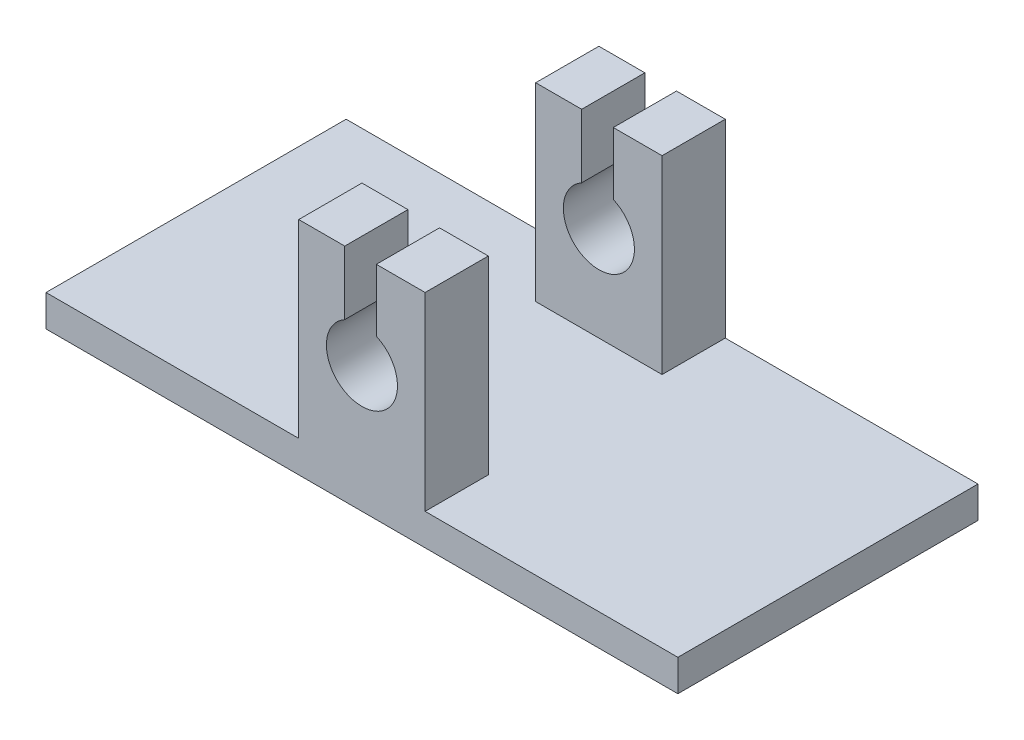
from build123d import *

# Parameters (mm, degrees)
SKETCH2_W           = 254
SKETCH2_H           = 120.65
BOSS_EXTRUDE2_DEPTH = 12.7
SKETCH4_W           = 50.8
SKETCH4_H           = 25.4
BOSS_EXTRUDE3_DEPTH = 76.2
CUT_EXTRUDE1_DEPTH  = 197.439895388


with BuildPart() as part:
    # Sketch2 → Boss-Extrude2 (new body)
    with BuildSketch(Plane(origin=(0, 0, 0), x_dir=(1, 0, 0), z_dir=(0, 1, 0))):
        Rectangle(SKETCH2_W, SKETCH2_H)
    extrude(amount=BOSS_EXTRUDE2_DEPTH)

    # Sketch4 → Boss-Extrude3 (add)
    with BuildSketch(Plane(origin=(0, 12.7, 0), x_dir=(1, 0, 0), z_dir=(0, 1, 0))):
        with Locations((0, -47.625)):
            Rectangle(SKETCH4_W, SKETCH4_H)
    boss_extrude3 = extrude(amount=BOSS_EXTRUDE3_DEPTH)

    # Mirror1: Boss-Extrude3 across plane
    add(boss_extrude3.mirror(Plane.XY))

    # Sketch6 → Cut-Extrude1 (cut, through all)
    with BuildSketch(Plane.XY.offset(60.325)):
        with BuildLine():
            Line((-6.911847883, 88.9), (5.788152117, 88.9))
            Line((5.788152117, 88.9), (5.788152117, 63.862540003))
            ThreePointArc((5.788152117, 63.862540003), (0.627347046, 36.526279674), (-6.911847883, 63.304359843))
            Line((-6.911847883, 63.304359843), (-6.911847883, 88.9))
        make_face()
    extrude(amount=-CUT_EXTRUDE1_DEPTH, mode=Mode.SUBTRACT)


solid = part.part
